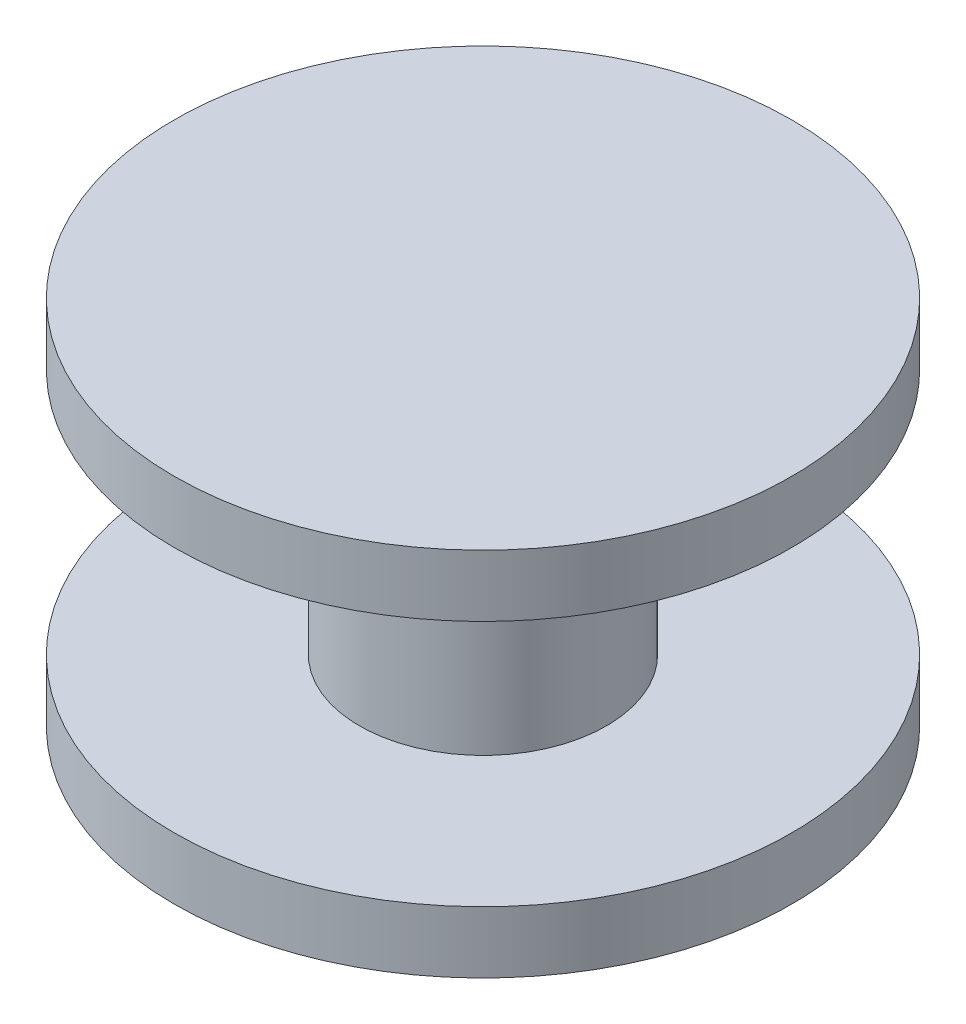
from build123d import *


with BuildPart() as part:
    # Sketch1 → Revolve3 (revolve)
    with BuildSketch(Plane.XY):
        Polygon((0, 0), (0, 19.05), (0, 38.1), (31.75, 38.1), (31.75, 31.75), (12.7, 31.75), (12.7, 19.05), (12.7, 6.35), (31.75, 6.35), (31.75, 0), align=None)
    revolve(axis=Axis((0, 19.05, 0), (0, 1, 0)))


solid = part.part
